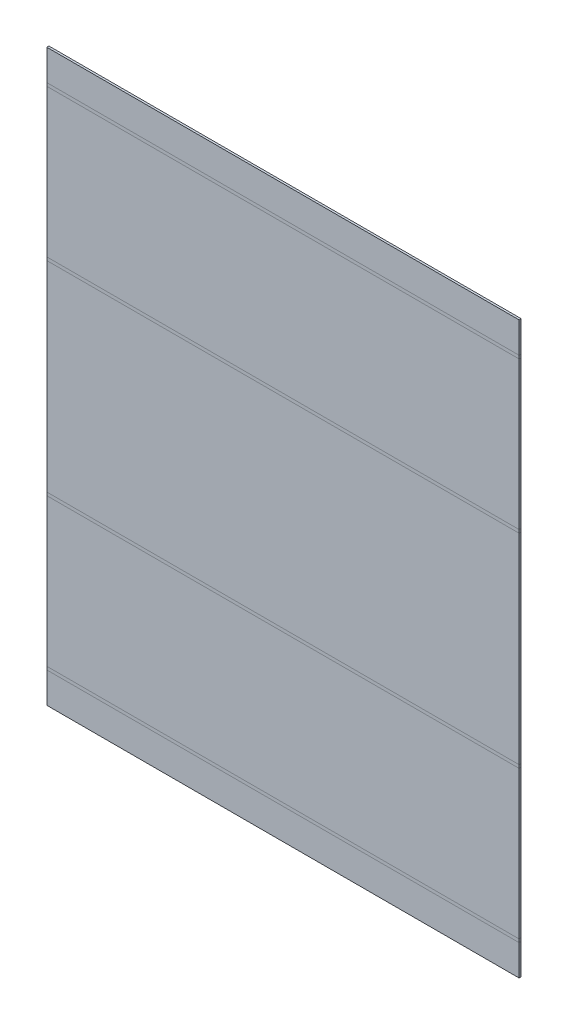
from build123d import *

# Parameters (mm, degrees)
SKETCH1_W                      = 1.5875
SKETCH1_H                      = 152.4
BASE_FLANGE1_DEPTH             = 355.6
EDGE_FLANGE1_STRIP_W           = 7.8232
EDGE_FLANGE1_STRIP_H           = 1.5875
EDGE_FLANGE1_STRIP_CUT_DEPTH   = 355.6
EDGE_FLANGE1_STRIP_2_W         = 7.8232
EDGE_FLANGE1_STRIP_2_H         = 1.5875
EDGE_FLANGE1_STRIP_CUT_2_DEPTH = 355.6
EDGE_FLANGE1_DEPTH             = 355.6
EDGE_FLANGE1_BEND_DEPTH        = 355.6
EDGE_FLANGE2_STRIP_W           = 7.8232
EDGE_FLANGE2_STRIP_H           = 1.5875
EDGE_FLANGE2_STRIP_CUT_DEPTH   = 355.6
EDGE_FLANGE2_STRIP_2_W         = 7.8232
EDGE_FLANGE2_STRIP_2_H         = 1.5875
EDGE_FLANGE2_STRIP_CUT_2_DEPTH = 355.6
EDGE_FLANGE2_DEPTH             = 355.6
EDGE_FLANGE2_BEND_DEPTH        = 355.6
UNFOLD1_OUTLINE_W              = 355.6
UNFOLD1_OUTLINE_H              = 203.2
UNFOLD1_DEPTH                  = 114.3
UNFOLD1_START                  = -1.5875
UNFOLD1_2_OUTLINE_W            = 355.6
UNFOLD1_2_OUTLINE_H            = 429.172672634
UNFOLD1_2_DEPTH                = 1.5875


# Read off the part's stored shape, not the designer's step: Unfold1
# Sheet-metal steps are written as plain solids
with BuildPart() as part:
    # Sketch1 → Base-Flange1 (new body)
    with BuildSketch(Plane(origin=(0, 0, 0), x_dir=(0, 0, -1), z_dir=(1, 0, 0))):
        with Locations((0.79375, 76.2)):
            Rectangle(SKETCH1_W, SKETCH1_H)
    extrude(amount=BASE_FLANGE1_DEPTH)

    # Edge-Flange1 strip (across the edge) → Edge-Flange1 strip cut (cut)
    with BuildSketch(Plane(origin=(355.6, 152.4, 0), x_dir=(0, -1, 0), z_dir=(-1, 0, 0))):
        with Locations((-3.175, -0.79375)):
            Rectangle(EDGE_FLANGE1_STRIP_W, EDGE_FLANGE1_STRIP_H)
    extrude(amount=EDGE_FLANGE1_STRIP_CUT_DEPTH, mode=Mode.SUBTRACT)

    # Edge-Flange1 strip 2 (across the edge) → Edge-Flange1 strip cut 2 (cut)
    with BuildSketch(Plane.YZ):
        with Locations((-3.175, -0.79375)):
            Rectangle(EDGE_FLANGE1_STRIP_2_W, EDGE_FLANGE1_STRIP_2_H)
    extrude(amount=EDGE_FLANGE1_STRIP_CUT_2_DEPTH, mode=Mode.SUBTRACT)

    # Edge-Flange1 section (across the edge) → Edge-Flange1 (add)
    with BuildSketch(Plane(origin=(355.6, 152.4, 0), x_dir=(0, -1, 0), z_dir=(-1, 0, 0))):
        with BuildLine():
            Line((-1.5875, 0.7366), (-1.5875, 112.7125))
            Line((-1.5875, 112.7125), (0, 112.7125))
            Line((0, 112.7125), (0, 0.7366))
            ThreePointArc((0, 0.7366), (0.215745145, 0.215745145), (0.7366, 0))
            Line((0.7366, 0), (0.7366, -1.5875))
            ThreePointArc((0.7366, -1.5875), (-0.90678687, -0.90678687), (-1.5875, 0.7366))
        make_face()
    extrude(amount=EDGE_FLANGE1_DEPTH)

    # Edge-Flange1 section 2 (across the edge) → Edge-Flange1 bend (add)
    with BuildSketch(Plane.YZ):
        with BuildLine():
            Line((-1.5875, 0.7366), (-1.5875, 112.7125))
            Line((-1.5875, 112.7125), (0, 112.7125))
            Line((0, 112.7125), (0, 0.7366))
            ThreePointArc((0, 0.7366), (0.215745145, 0.215745145), (0.7366, 0))
            Line((0.7366, 0), (0.7366, -1.5875))
            ThreePointArc((0.7366, -1.5875), (-0.90678687, -0.90678687), (-1.5875, 0.7366))
        make_face()
    extrude(amount=EDGE_FLANGE1_BEND_DEPTH)

    # Edge-Flange2 strip (across the edge) → Edge-Flange2 strip cut (cut)
    with BuildSketch(Plane(origin=(0, 153.9875, 112.7125), x_dir=(0, 0, -1), z_dir=(1, 0, 0))):
        with Locations((-3.175, -0.79375)):
            Rectangle(EDGE_FLANGE2_STRIP_W, EDGE_FLANGE2_STRIP_H)
    extrude(amount=EDGE_FLANGE2_STRIP_CUT_DEPTH, mode=Mode.SUBTRACT)

    # Edge-Flange2 strip 2 (across the edge) → Edge-Flange2 strip cut 2 (cut)
    with BuildSketch(Plane(origin=(355.6, -1.5875, 112.7125), x_dir=(0, 0, -1), z_dir=(-1, 0, 0))):
        with Locations((-3.175, -0.79375)):
            Rectangle(EDGE_FLANGE2_STRIP_2_W, EDGE_FLANGE2_STRIP_2_H)
    extrude(amount=EDGE_FLANGE2_STRIP_CUT_2_DEPTH, mode=Mode.SUBTRACT)

    # Edge-Flange2 section (across the edge) → Edge-Flange2 (add)
    with BuildSketch(Plane(origin=(0, 153.9875, 112.7125), x_dir=(0, 0, -1), z_dir=(1, 0, 0))):
        with BuildLine():
            Line((-1.5875, 0.7366), (-1.5875, 23.8125))
            Line((-1.5875, 23.8125), (0, 23.8125))
            Line((0, 23.8125), (0, 0.7366))
            ThreePointArc((0, 0.7366), (0.215745145, 0.215745145), (0.7366, 0))
            Line((0.7366, 0), (0.7366, -1.5875))
            ThreePointArc((0.7366, -1.5875), (-0.90678687, -0.90678687), (-1.5875, 0.7366))
        make_face()
    extrude(amount=EDGE_FLANGE2_DEPTH)

    # Edge-Flange2 section 2 (across the edge) → Edge-Flange2 bend (add)
    with BuildSketch(Plane(origin=(355.6, -1.5875, 112.7125), x_dir=(0, 0, -1), z_dir=(-1, 0, 0))):
        with BuildLine():
            Line((-1.5875, 0.7366), (-1.5875, 23.8125))
            Line((-1.5875, 23.8125), (0, 23.8125))
            Line((0, 23.8125), (0, 0.7366))
            ThreePointArc((0, 0.7366), (0.215745145, 0.215745145), (0.7366, 0))
            Line((0.7366, 0), (0.7366, -1.5875))
            ThreePointArc((0.7366, -1.5875), (-0.90678687, -0.90678687), (-1.5875, 0.7366))
        make_face()
    extrude(amount=EDGE_FLANGE2_BEND_DEPTH)

    # Unfold1 outline → Unfold1 (cut)
    with BuildSketch(Plane.XY):
        with Locations((177.8, 76.2)):
            Rectangle(UNFOLD1_OUTLINE_W, UNFOLD1_OUTLINE_H)
    extrude(amount=UNFOLD1_DEPTH, mode=Mode.SUBTRACT)

    # Unfold1 2 outline → Unfold1 2 (add)
    with BuildSketch(Plane.XY.offset(UNFOLD1_START)):
        with Locations((177.8, 76.2)):
            Rectangle(UNFOLD1_2_OUTLINE_W, UNFOLD1_2_OUTLINE_H)
    extrude(amount=UNFOLD1_2_DEPTH)


solid = part.part
